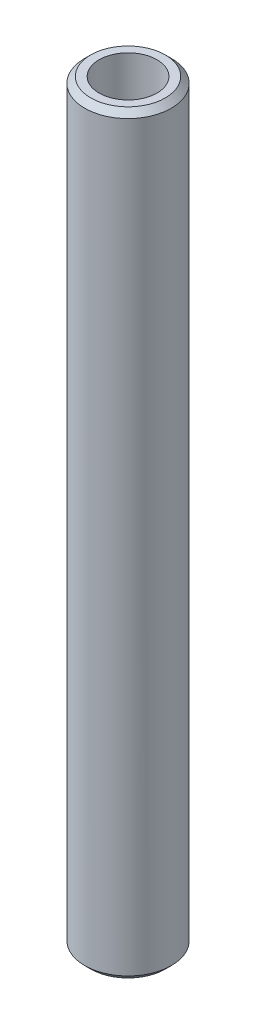
from build123d import *

# Parameters (mm, degrees)
SKETCH1_R           = 25
BOSS_EXTRUDE1_DEPTH = 435.950441471
SKETCH2_R           = 16.716597955
CUT_EXTRUDE1_DEPTH  = 438.381741067
CHAMFER1_SIZE       = 3.45081802


with BuildPart() as part:
    # Sketch1 → Boss-Extrude1 (new body)
    with BuildSketch(Plane(origin=(0, 0, 0), x_dir=(1, 0, 0), z_dir=(0, 1, 0))):
        Circle(SKETCH1_R)
    extrude(amount=BOSS_EXTRUDE1_DEPTH)

    # Sketch2 → Cut-Extrude1 (cut, through all)
    with BuildSketch(Plane(origin=(0, 0, 0), x_dir=(1, 0, 0), z_dir=(0, 1, 0))):
        Circle(SKETCH2_R)
    extrude(amount=CUT_EXTRUDE1_DEPTH, mode=Mode.SUBTRACT)

    # Chamfer1
    chamfer1_edges = [part.edges().sort_by_distance(p)[0] for p in [
        (-25, 435.950441471, 0),
        (-25, 0, 0),
    ]]
    chamfer(chamfer1_edges, length=CHAMFER1_SIZE)


solid = part.part
